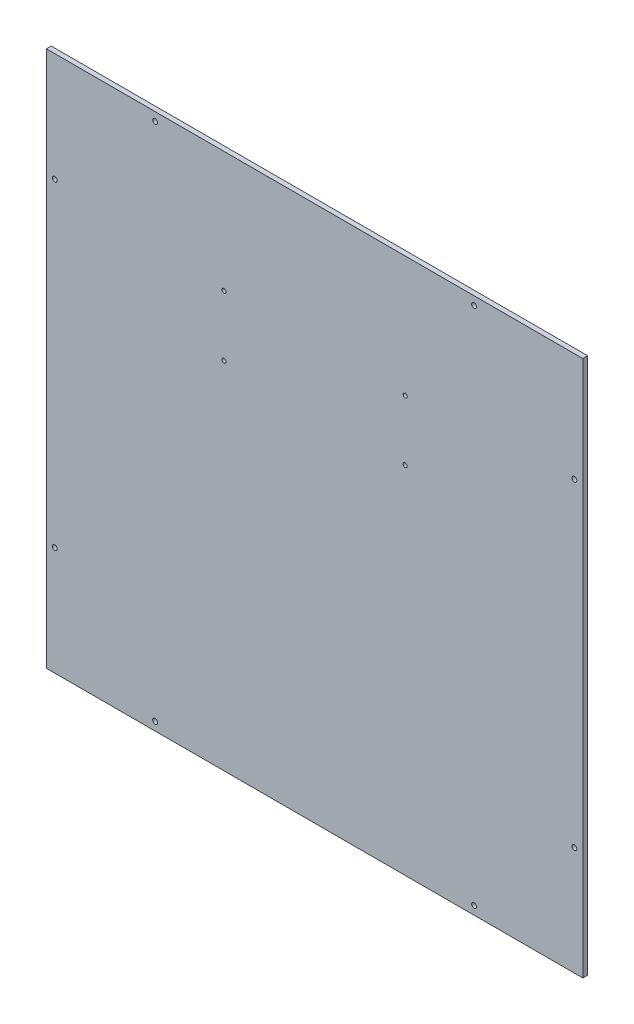
from build123d import *

# Parameters (mm, degrees)
SCHIZZO1_W                   = 444
SCHIZZO1_H                   = 444
SCHIZZO1_R                   = 2
ESTRUSIONE_ESTRUSIONE1_DEPTH = 4
SCHIZZO2_R                   = 1.7
TAGLIO_ESTRUSIONE1_DEPTH     = 628.923562227


with BuildPart() as part:
    # Schizzo1 → Estrusione-Estrusione1 (new body)
    with BuildSketch(Plane.XY):
        with Locations((222, 222)):
            Rectangle(SCHIZZO1_W, SCHIZZO1_H)
        with Locations((90, 437)):
            Circle(SCHIZZO1_R, mode=Mode.SUBTRACT)
        with Locations((354, 437)):
            Circle(SCHIZZO1_R, mode=Mode.SUBTRACT)
        with Locations((437, 354)):
            Circle(SCHIZZO1_R, mode=Mode.SUBTRACT)
        with Locations((7, 354)):
            Circle(SCHIZZO1_R, mode=Mode.SUBTRACT)
        with Locations((437, 90)):
            Circle(SCHIZZO1_R, mode=Mode.SUBTRACT)
        with Locations((354, 7)):
            Circle(SCHIZZO1_R, mode=Mode.SUBTRACT)
        with Locations((90, 7)):
            Circle(SCHIZZO1_R, mode=Mode.SUBTRACT)
        with Locations((7, 90)):
            Circle(SCHIZZO1_R, mode=Mode.SUBTRACT)
    extrude(amount=ESTRUSIONE_ESTRUSIONE1_DEPTH)

    # Schizzo2 → Taglio-Estrusione1 (cut, through all)
    with BuildSketch(Plane.XY.offset(4)):
        with Locations((147, 344)):
            Circle(SCHIZZO2_R)
        with Locations((147, 294)):
            Circle(SCHIZZO2_R)
        with Locations((297, 344)):
            Circle(SCHIZZO2_R)
        with Locations((297, 294)):
            Circle(SCHIZZO2_R)
    extrude(amount=-TAGLIO_ESTRUSIONE1_DEPTH, mode=Mode.SUBTRACT)


solid = part.part
